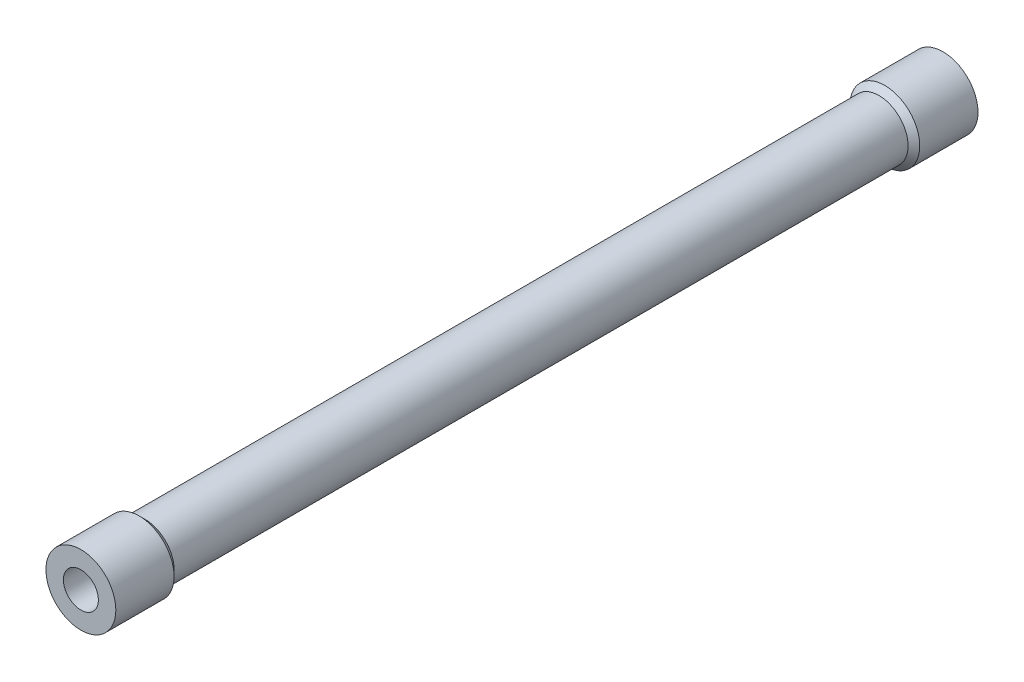
from build123d import *

# Parameters (mm, degrees)
SKETCH1_R                = 2.5
SKETCH1_R_2              = 1.5
BOSS_EXTRUDE1_DEPTH      = 74
BOSS_EXTRUDE2_START      = -6
SKETCH2_R                = 3
SKETCH2_R_2              = 1.5
BOSS_EXTRUDE2_DEPTH      = 6
CHAMFER1_SIZE            = 1
CHAMFER1_OF_MIRROR1_SIZE = 1


with BuildPart() as part:
    # Sketch1 → Boss-Extrude1 (new body)
    with BuildSketch(Plane.XY):
        Circle(SKETCH1_R)
        Circle(SKETCH1_R_2, mode=Mode.SUBTRACT)
    extrude(amount=BOSS_EXTRUDE1_DEPTH)

    # Sketch2 → Boss-Extrude2 (add)
    with BuildSketch(Plane.XY.offset(74).offset(BOSS_EXTRUDE2_START)):
        Circle(SKETCH2_R)
        Circle(SKETCH2_R_2, mode=Mode.SUBTRACT)
    boss_extrude2 = extrude(amount=BOSS_EXTRUDE2_DEPTH)

    # Chamfer1
    # the kernel refuses this chamfer: 1 mm, written as the material it takes off along each edge
    with BuildSketch(Plane(origin=(0, 0, 68), x_dir=(1, 0, 0), z_dir=(0, -1, 0))) as chamfer1_piece_1_section:
        Polygon((3 - CHAMFER1_SIZE, 0), (3, CHAMFER1_SIZE), (3, 0), align=None)
    chamfer1_piece_1 = revolve(axis=Axis((0, 0, 68), (0, 0, 1)), mode=Mode.PRIVATE)
    chamfer1_piece_1 = chamfer1_piece_1 - Plane(origin=(0, 0, 68.750504242), x_dir=(1, 0, 0), z_dir=(0, 0, -1)) * Cylinder(2.5, 12, mode=Mode.PRIVATE)
    add(chamfer1_piece_1, mode=Mode.SUBTRACT)

    # Mirror1: Boss-Extrude2 across plane
    add(boss_extrude2.mirror(Plane.XY.offset(37)))

    # Chamfer1 of Mirror1
    # the kernel refuses this chamfer: 1 mm, written as the material it takes off along each edge
    with BuildSketch(Plane(origin=(0, 0, 6), x_dir=(1, 0, 0), z_dir=(0, -1, 0))) as chamfer1_of_mirror1_piece_1_section:
        Polygon((3, -CHAMFER1_OF_MIRROR1_SIZE), (3 - CHAMFER1_OF_MIRROR1_SIZE, 0), (3, 0), align=None)
    chamfer1_of_mirror1_piece_1 = revolve(axis=Axis((0, 0, 6), (0, 0, 1)), mode=Mode.PRIVATE)
    chamfer1_of_mirror1_piece_1 = chamfer1_of_mirror1_piece_1 - Plane(origin=(0, 0, 5.249495758), x_dir=(1, 0, 0), z_dir=(0, 0, -1)) * Cylinder(2.5, 12, mode=Mode.PRIVATE)
    add(chamfer1_of_mirror1_piece_1, mode=Mode.SUBTRACT)


solid = part.part
